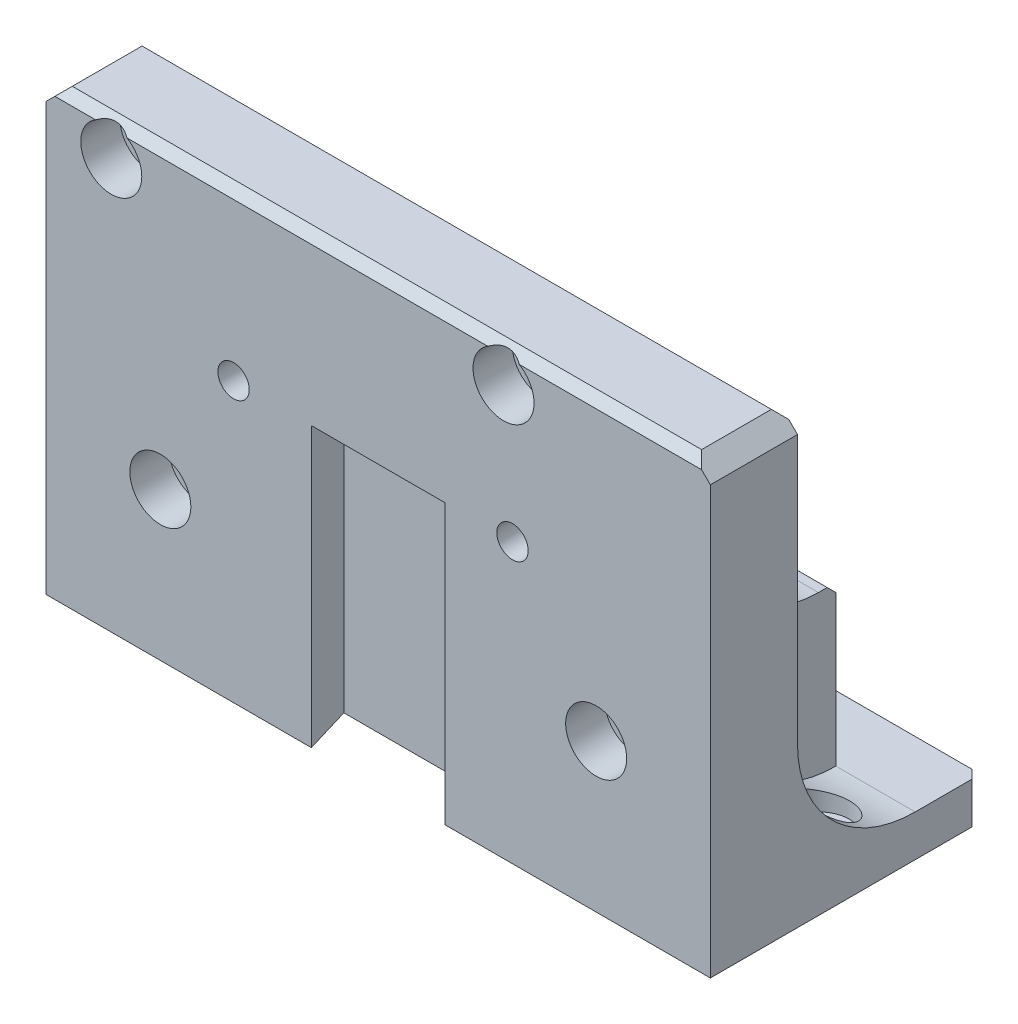
from build123d import *

# Parameters (mm, degrees)
SKETCH1_W                = 76.2
SKETCH1_H                = 51
BOSS_EXTRUDE1_DEPTH      = 10
CHAMFER1_SIZE            = 2
BOSS_EXTRUDE2_DEPTH      = 38.1
BOSS_EXTRUDE2_DEPTH_BACK = 38.1
SKETCH2_W                = 32
SKETCH2_H                = 4.75
CUT_EXTRUDE1_DEPTH       = 32
FILLET1_R                = 13.5
SKETCH4_R                = 4
CUT_EXTRUDE2_DEPTH       = 10
BOSS_EXTRUDE4_START      = -9.1
SKETCH5_W                = 13.5
SKETCH5_H                = 18.25
BOSS_EXTRUDE4_DEPTH      = 8
BOSS_EXTRUDE5_START      = -67.1
SKETCH5_4_W              = 13.5
SKETCH5_4_H              = 18.25
BOSS_EXTRUDE5_DEPTH      = 8
FILLET2_R                = 11.5
BOSS_EXTRUDE6_START      = -9.64
SKETCH7_W                = 13.5
SKETCH7_H                = 10
BOSS_EXTRUDE6_DEPTH      = 6.5
BOSS_EXTRUDE7_START      = -32.36
SKETCH7_2_W              = 13.5
SKETCH7_2_H              = 10
BOSS_EXTRUDE7_DEPTH      = 6.65
FILLET3_R                = 11.5
CHAMFER3_SIZE            = 2
CHAMFER4_SIZE            = 1
SKETCH8_R                = 3.5
SKETCH8_R_2              = 1.8
CUT_EXTRUDE3_DEPTH       = 4.5
SKETCH8_4_R              = 1.8
CUT_EXTRUDE6_DEPTH       = 56.909391028
LPATTERN1_COUNT          = 2
LPATTERN1_PITCH          = 45
SKETCH10_6_R             = 1.8
CUT_EXTRUDE17_DEPTH      = 51.851352048
SKETCH10_R               = 3.5
SKETCH10_R_2             = 1.8
CUT_EXTRUDE11_DEPTH      = 3
SKETCH12_R               = 1.8
CUT_EXTRUDE13_DEPTH      = 56.909391028
SKETCH12_4_R             = 3.5
SKETCH12_4_R_2           = 1.8
CUT_EXTRUDE14_DEPTH      = 4.5
LPATTERN3_COUNT          = 2
LPATTERN3_PITCH          = 50
CUT_EXTRUDE18_DEPTH      = 71.73817429
CUT_EXTRUDE18_DEPTH_BACK = 2.5
SKETCH13_W               = 35
SKETCH13_H               = 12
FILLET4_R                = 8.5
CUT_EXTRUDE19_DEPTH      = 68.931380819
CUT_EXTRUDE19_DEPTH_BACK = 1.5
SKETCH14_R               = 3.5
SKETCH14_R_2             = 1.8
CUT_EXTRUDE20_DEPTH      = 68.931380875
CUT_EXTRUDE20_DEPTH_BACK = 68.931380875
SKETCH14_4_R             = 1.8


with BuildPart() as part:
    # Sketch1 → Boss-Extrude1 (new body)
    with BuildSketch(Plane.XY):
        Rectangle(SKETCH1_W, SKETCH1_H)
    extrude(amount=-BOSS_EXTRUDE1_DEPTH)

    # Chamfer1
    chamfer1_edges = [part.edges().sort_by_distance(p)[0] for p in [
        (-38.1, 25.5, -5),
        (38.1, 25.5, -5),
    ]]
    chamfer(chamfer1_edges, length=CHAMFER1_SIZE)

    # Sketch2 → Boss-Extrude2 (add, two sides: drawn at the far end of the back side and taken through both)
    with BuildSketch(Plane(origin=(0, 0, 0), x_dir=(0, 0, -1), z_dir=(1, 0, 0)).offset(-BOSS_EXTRUDE2_DEPTH_BACK)):
        with Locations((16, -23.125)):
            Rectangle(SKETCH2_W, SKETCH2_H)
    extrude(amount=BOSS_EXTRUDE2_DEPTH + BOSS_EXTRUDE2_DEPTH_BACK)

    # Sketch3 → Cut-Extrude1 (cut)
    with BuildSketch(Plane(origin=(0, -25.5, 0), x_dir=(-1, 0, 0), z_dir=(0, -1, 0))):
        Polygon((-7.67217, 0), (7.67217, 0), (9.268805, 5.32212), (-9.268805, 5.32212), align=None)
    extrude(amount=-CUT_EXTRUDE1_DEPTH, mode=Mode.SUBTRACT)

    # Fillet1
    fillet1_edges = [part.edges().sort_by_distance(p)[0] for p in [
        (0, -20.75, -10),
    ]]
    fillet(fillet1_edges, radius=FILLET1_R)

    # Sketch4 → Cut-Extrude2 (cut)
    with BuildSketch(Plane.XZ.offset(25.5)):
        with Locations((0, -11.5)):
            Circle(SKETCH4_R)
    extrude(amount=-CUT_EXTRUDE2_DEPTH, mode=Mode.SUBTRACT)

    # Sketch5 → Boss-Extrude4 (add)
    with BuildSketch(Plane(origin=(38.1, 0, 0), x_dir=(0, 0, -1), z_dir=(1, 0, 0)).offset(BOSS_EXTRUDE4_START)):
        with Locations((16.75, -11.625)):
            Rectangle(SKETCH5_W, SKETCH5_H)
    extrude(amount=-BOSS_EXTRUDE4_DEPTH)

    # Sketch5<4> → Boss-Extrude5 (add)
    with BuildSketch(Plane(origin=(38.1, 0, 0), x_dir=(0, 0, -1), z_dir=(1, 0, 0)).offset(BOSS_EXTRUDE5_START)):
        with Locations((16.75, -11.625)):
            Rectangle(SKETCH5_4_W, SKETCH5_4_H)
    extrude(amount=BOSS_EXTRUDE5_DEPTH)

    # Fillet2
    fillet2_edges = [part.edges().sort_by_distance(p)[0] for p in [
        (25, -2.5, -10),
        (-25, -2.5, -10),
    ]]
    fillet(fillet2_edges, radius=FILLET2_R)

    # Sketch7 → Boss-Extrude6 (add)
    with BuildSketch(Plane(origin=(21, 0, 0), x_dir=(0, 0, -1), z_dir=(1, 0, 0)).offset(BOSS_EXTRUDE6_START)):
        with Locations((16.75, 4)):
            Rectangle(SKETCH7_W, SKETCH7_H)
    extrude(amount=-BOSS_EXTRUDE6_DEPTH)

    # Sketch7<2> → Boss-Extrude7 (add)
    with BuildSketch(Plane(origin=(21, 0, 0), x_dir=(0, 0, -1), z_dir=(1, 0, 0)).offset(BOSS_EXTRUDE7_START)):
        with Locations((16.75, 4)):
            Rectangle(SKETCH7_2_W, SKETCH7_2_H)
    extrude(amount=BOSS_EXTRUDE7_DEPTH)

    # Fillet3
    # the kernel refuses this fillet: 11.5 mm, written as the material it adds along each edge
    with BuildSketch(Plane(origin=(11.36, -1, -10), x_dir=(0, -1, 0), z_dir=(-1, 0, 0))) as fillet3_piece_1:
        with BuildLine():
            CenterArc((FILLET3_R, -FILLET3_R), FILLET3_R, 90, 90)
            Line((0, -FILLET3_R), (0, 0))
            Line((0, 0), (FILLET3_R, 0))
        make_face()
    extrude(amount=6.5)
    with BuildSketch(Plane(origin=(11.36, -1, -10), x_dir=(0, -1, 0), z_dir=(-1, 0, 0))) as fillet3_piece_2_section:
        with BuildLine():
            CenterArc((FILLET3_R, -FILLET3_R), FILLET3_R, 90, 90)
            Line((0, -FILLET3_R), (0, 0))
            Line((0, 0), (FILLET3_R, 0))
        make_face()
    fillet3_piece_2 = extrude(amount=35.25, mode=Mode.PRIVATE)
    fillet3_piece_2 = split(fillet3_piece_2, bisect_by=Plane(origin=(-4.71, -3.603543814, -12.603543814), z_dir=(-1, 0, 0)), keep=Keep.TOP, mode=Mode.PRIVATE)
    fillet3_piece_2 = split(fillet3_piece_2, bisect_by=Plane(origin=(-11.36, -3.603543814, -12.603543814), z_dir=(1, 0, 0)), keep=Keep.TOP, mode=Mode.PRIVATE)
    add(fillet3_piece_2)
    with BuildSketch(Plane(origin=(-11.36, -1, -10), x_dir=(0, -1, 0), z_dir=(1, 0, 0))) as fillet3_piece_3:
        with BuildLine():
            CenterArc((FILLET3_R, FILLET3_R), FILLET3_R, 180, 90)
            Line((0, FILLET3_R), (0, 0))
            Line((0, 0), (FILLET3_R, 0))
        make_face()
    extrude(amount=6.65)
    with BuildSketch(Plane(origin=(-11.36, -1, -10), x_dir=(0, -1, 0), z_dir=(1, 0, 0))) as fillet3_piece_4_section:
        with BuildLine():
            CenterArc((FILLET3_R, FILLET3_R), FILLET3_R, 180, 90)
            Line((0, FILLET3_R), (0, 0))
            Line((0, 0), (FILLET3_R, 0))
        make_face()
    fillet3_piece_4 = extrude(amount=35.4, mode=Mode.PRIVATE)
    fillet3_piece_4 = split(fillet3_piece_4, bisect_by=Plane(origin=(11.36, -3.603543814, -12.603543814), z_dir=(-1, 0, 0)), keep=Keep.TOP, mode=Mode.PRIVATE)
    fillet3_piece_4 = split(fillet3_piece_4, bisect_by=Plane(origin=(4.86, -3.603543814, -12.603543814), z_dir=(1, 0, 0)), keep=Keep.TOP, mode=Mode.PRIVATE)
    add(fillet3_piece_4)

    # Chamfer3
    chamfer3_edges = [part.edges().sort_by_distance(p)[0] for p in [
        (38.1, -23.125, -32),
        (-38.1, -23.125, -32),
    ]]
    chamfer(chamfer3_edges, length=CHAMFER3_SIZE)

    # Chamfer4
    chamfer4_edges = [part.edges().sort_by_distance(p)[0] for p in [
        (-25, -2.5, -23.5),
        (8.11, 9, -23.5),
        (8.11, -1, -23.5),
        (0, 25.5, 0),
        (-8.035, -1, -23.5),
        (-8.035, 9, -23.5),
        (0, 25.5, -10),
        (0, -20.75, -32),
        (25, -2.5, -23.5),
    ]]
    chamfer(chamfer4_edges, length=CHAMFER4_SIZE)

    # Sketch8 → Cut-Extrude3 (cut)
    with BuildSketch(Plane.XY):
        with Locations((-30.63, 21.5)):
            Circle(SKETCH8_R)
        with Locations((-30.63, 21.5)):
            Circle(SKETCH8_R_2, mode=Mode.SUBTRACT)
    cut_extrude3 = extrude(amount=-CUT_EXTRUDE3_DEPTH, mode=Mode.SUBTRACT)

    # Sketch8<4> → Cut-Extrude6 (cut, through all)
    with BuildSketch(Plane.XY):
        with Locations((-30.63, 21.5)):
            Circle(SKETCH8_4_R)
    cut_extrude6 = extrude(amount=-CUT_EXTRUDE6_DEPTH, mode=Mode.SUBTRACT)

    # LPattern1: Cut-Extrude3, Cut-Extrude6 ×2
    with Locations(*[(i * LPATTERN1_PITCH, 0, 0) for i in range(1, LPATTERN1_COUNT)]):
        add(cut_extrude3, mode=Mode.SUBTRACT)
        add(cut_extrude6, mode=Mode.SUBTRACT)

    # Sketch10<6> → Cut-Extrude17 (cut, through all)
    with BuildSketch(Plane.XY.offset(-10)):
        with Locations(Location((-16.6, 6.5, 0), (0, 0, 180))):
            Circle(SKETCH10_6_R)
        with Locations(Location((15.4, 6.5, 0), (0, 0, 180))):
            Circle(SKETCH10_6_R)
    extrude(amount=CUT_EXTRUDE17_DEPTH, mode=Mode.SUBTRACT)

    # Sketch10 → Cut-Extrude11 (cut)
    # profile 1 of 2: a face of its own
    with BuildSketch(Plane.XY.offset(-10)):
        with Locations(Location((-16.6, 6.5, 0), (0, 0, 180))):
            Circle(SKETCH10_R)
        with Locations(Location((-16.6, 6.5, 0), (0, 0, 180))):
            Circle(SKETCH10_R_2, mode=Mode.SUBTRACT)
    # profile 2 of 2: a face of its own
    with BuildSketch(Plane.XY.offset(-10)):
        with Locations(Location((15.4, 6.5, 0), (0, 0, 180))):
            Circle(SKETCH10_R)
        with Locations(Location((15.4, 6.5, 0), (0, 0, 180))):
            Circle(SKETCH10_R_2, mode=Mode.SUBTRACT)
    extrude(amount=CUT_EXTRUDE11_DEPTH, mode=Mode.SUBTRACT)

    # Sketch12 → Cut-Extrude13 (cut, through all)
    with BuildSketch(Plane.XY):
        with Locations((-25, -8.5)):
            Circle(SKETCH12_R)
    cut_extrude13 = extrude(amount=-CUT_EXTRUDE13_DEPTH, mode=Mode.SUBTRACT)

    # Sketch12<4> → Cut-Extrude14 (cut)
    with BuildSketch(Plane.XY):
        with Locations((-25, -8.5)):
            Circle(SKETCH12_4_R)
        with Locations((-25, -8.5)):
            Circle(SKETCH12_4_R_2, mode=Mode.SUBTRACT)
    cut_extrude14 = extrude(amount=-CUT_EXTRUDE14_DEPTH, mode=Mode.SUBTRACT)

    # LPattern3: Cut-Extrude13, Cut-Extrude14 ×2
    with Locations(*[(i * LPATTERN3_PITCH, 0, 0) for i in range(1, LPATTERN3_COUNT)]):
        add(cut_extrude13, mode=Mode.SUBTRACT)
        add(cut_extrude14, mode=Mode.SUBTRACT)

    # Sketch13 → Cut-Extrude18 (cut, two sides: drawn at the far end of the back side and taken through both)
    with BuildSketch(Plane(origin=(0, -20.75, 5.592775926), x_dir=(1, 0, 0), z_dir=(0, 1, 0)).offset(-CUT_EXTRUDE18_DEPTH_BACK)):
        with Locations((0, 31.592775926)):
            Rectangle(SKETCH13_W, SKETCH13_H)
    extrude(amount=CUT_EXTRUDE18_DEPTH + CUT_EXTRUDE18_DEPTH_BACK, mode=Mode.SUBTRACT)

    # Fillet4
    # the kernel refuses this fillet: 8.5 mm, written as the material it adds along each edge
    with BuildSketch(Plane(origin=(33.619877511, -23.25, -20), x_dir=(0, 0, -1), z_dir=(-1, 0, 0))) as fillet4_piece_1:
        with BuildLine():
            CenterArc((6.447951004, -8.5), FILLET4_R, 90, 49.339390538)
            Line((0, -2.96159519), (-0.12895902, -2.850827093))
            ThreePointArc((-0.12895902, -2.850827093), (-0.17, -1.480797595), (-0.17, 0))
            Line((-0.17, 0), (0, 0.17))
            Line((0, 0.17), (6.447951004, 0.17))
            Line((6.447951004, 0.17), (6.447951004, 0))
        make_face()
    extrude(amount=67.239755022)

    # Sketch14 → Cut-Extrude19 (cut, two sides: drawn at the far end of the back side and taken through both)
    # profile 1 of 2: a face of its own
    with BuildSketch(Plane(origin=(0, -20.75, 0), x_dir=(1, 0, 0), z_dir=(0, 1, 0)).offset(-CUT_EXTRUDE19_DEPTH_BACK)):
        with Locations(Location((-33.55, 17, 0), (0, 0, 90))):
            Circle(SKETCH14_R)
        with Locations(Location((-33.55, 17, 0), (0, 0, 90))):
            Circle(SKETCH14_R_2, mode=Mode.SUBTRACT)
    # profile 2 of 2: a face of its own
    with BuildSketch(Plane(origin=(0, -20.75, 0), x_dir=(1, 0, 0), z_dir=(0, 1, 0)).offset(-CUT_EXTRUDE19_DEPTH_BACK)):
        with Locations(Location((33.55, 17, 0), (0, 0, 90))):
            Circle(SKETCH14_R)
        with Locations(Location((33.55, 17, 0), (0, 0, 90))):
            Circle(SKETCH14_R_2, mode=Mode.SUBTRACT)
    extrude(amount=CUT_EXTRUDE19_DEPTH + CUT_EXTRUDE19_DEPTH_BACK, mode=Mode.SUBTRACT)

    # Sketch14<4> → Cut-Extrude20 (cut, two sides: drawn at the far end of the back side and taken through both)
    with BuildSketch(Plane(origin=(0, -20.75, 0), x_dir=(1, 0, 0), z_dir=(0, 1, 0)).offset(-CUT_EXTRUDE20_DEPTH_BACK)):
        with Locations(Location((33.55, 17, 0), (0, 0, 270))):
            Circle(SKETCH14_4_R)
        with Locations(Location((-33.55, 17, 0), (0, 0, 270))):
            Circle(SKETCH14_4_R)
    extrude(amount=CUT_EXTRUDE20_DEPTH + CUT_EXTRUDE20_DEPTH_BACK, mode=Mode.SUBTRACT)


solid = part.part
